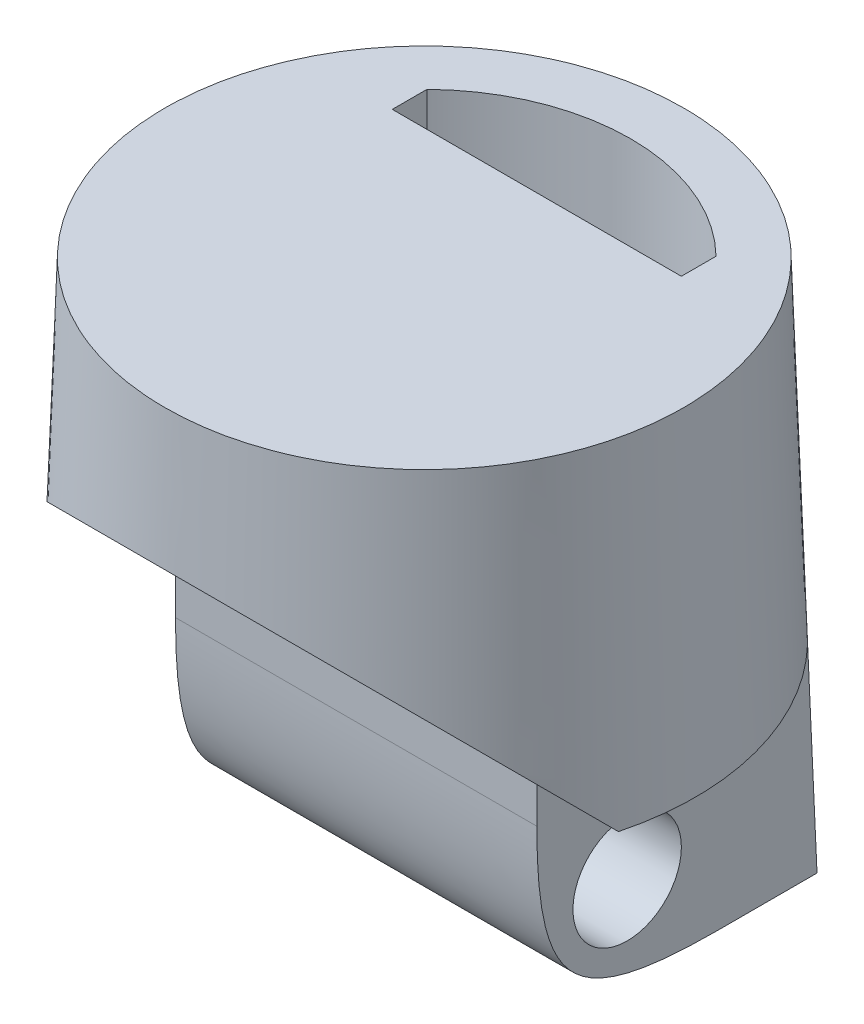
from build123d import *

# Parameters (mm, degrees)
SKETCH1_R                     = 7.5
BOSS_EXTRUDE1_DEPTH           = 19
BOSS_EXTRUDE1_TAPER           = 2
BOSS_EXTRUDE1_OTHER_WAY_DEPTH = 6
BOSS_EXTRUDE1_OTHER_WAY_TAPER = -2
CUT_EXTRUDE1_DEPTH            = 22.90601606
CUT_EXTRUDE1_DEPTH_BACK       = 22.90601606
CUT_EXTRUDE2_START            = -9.595582485
CUT_EXTRUDE2_OUTLINE_W        = 6.502745185
CUT_EXTRUDE2_OUTLINE_H        = 6
CUT_EXTRUDE2_DEPTH            = 9.595582485
SKETCH5_R                     = 1.5
CUT_EXTRUDE3_DEPTH            = 25.014303442
FILLET1_SIZE                  = 5
CUT_EXTRUDE4_DEPTH            = 22.833157665
CUT_EXTRUDE4_DEPTH_BACK       = 22.833157665
SKETCH6_W                     = 18.67842866
SKETCH6_H                     = 10.820279471
CUT_EXTRUDE5_DEPTH            = 19.604050317


with BuildPart() as part:
    # Sketch1 → Boss-Extrude1 (new body)
    with BuildSketch(Plane(origin=(0, 0, 0), x_dir=(1, 0, 0), z_dir=(0, 1, 0))):
        Circle(SKETCH1_R)
    extrude(amount=BOSS_EXTRUDE1_DEPTH, taper=BOSS_EXTRUDE1_TAPER)

    # Sketch1 → Boss-Extrude1 other way (add)
    with BuildSketch(Plane(origin=(0, 0, 0), x_dir=(1, 0, 0), z_dir=(0, 1, 0))):
        Circle(SKETCH1_R)
    extrude(amount=-BOSS_EXTRUDE1_OTHER_WAY_DEPTH, taper=BOSS_EXTRUDE1_OTHER_WAY_TAPER)

    # Sketch3 → Cut-Extrude1 (cut, two sides: drawn at the far end of the back side and taken through both)
    with BuildSketch(Plane(origin=(0, 0, 0), x_dir=(0, 0, -1), z_dir=(1, 0, 0)).offset(-CUT_EXTRUDE1_DEPTH_BACK)):
        Polygon((-1.886057768, -6), (-1.886057768, 0), (-9.929766736, 8.043708969), (-9.929766736, -6), align=None)
    extrude(amount=CUT_EXTRUDE1_DEPTH + CUT_EXTRUDE1_DEPTH_BACK, mode=Mode.SUBTRACT)

    # Cut-Extrude2: read off the stored shape, not the designer's step
    # Cut-Extrude2 outline → Cut-Extrude2 (cut)
    with BuildSketch(Plane.XY.offset(1.886057768).offset(CUT_EXTRUDE2_START)):
        with Locations((-8.251372593, -3)):
            Rectangle(CUT_EXTRUDE2_OUTLINE_W, CUT_EXTRUDE2_OUTLINE_H)
        with Locations((8.251372593, -3)):
            Rectangle(CUT_EXTRUDE2_OUTLINE_W, CUT_EXTRUDE2_OUTLINE_H)
    extrude(amount=CUT_EXTRUDE2_DEPTH, mode=Mode.SUBTRACT)

    # Sketch5 → Cut-Extrude3 (cut, through all)
    with BuildSketch(Plane(origin=(5, 0, 0), x_dir=(0, 0, -1), z_dir=(1, 0, 0))):
        with Locations((0.613942232, -3.5)):
            Circle(SKETCH5_R)
    extrude(amount=-CUT_EXTRUDE3_DEPTH, mode=Mode.SUBTRACT)

    # Fillet1
    # a fillet whose section is not a circle: 5 mm, written as the material it takes off along each edge
    with BuildSketch(Plane(origin=(17.5, -6, 1.886057768), x_dir=(0, 0, -1), z_dir=(-1, 0, 0))) as fillet1_piece_1:
        with BuildLine():
            Bezier((FILLET1_SIZE, 0), (0, 0), (0, -FILLET1_SIZE), weights=[1, 1.5, 1])
            Line((0, -FILLET1_SIZE), (0, 0))
            Line((0, 0), (FILLET1_SIZE, 0))
        make_face()
    extrude(amount=35, mode=Mode.SUBTRACT)

    # Fillet2
    # a fillet whose section is not a circle: 10, 5 mm, written as the material it takes off along each edge
    with BuildSketch(Plane(origin=(0, 19, 0), x_dir=(1, 0, 0), z_dir=(0, 0, -1))) as fillet2_piece_1:
        with BuildLine():
            Bezier((7.179619488, 9.825502516), (6.83650538, 0), (2.182665353, 0), weights=[1, 0.818181818, 1])
            Line((2.182665353, 0), (6.83650538, 0))
            Line((6.83650538, 0), (7.179619488, 9.825502516))
        make_face()
    revolve(axis=Axis((0, 19, 0), (0, -1, 0)), mode=Mode.SUBTRACT)

    # Sketch6 → Cut-Extrude4 (cut, two sides: drawn at the far end of the back side and taken through both)
    with BuildSketch(Plane(origin=(0, 0, 0), x_dir=(0, 0, -1), z_dir=(1, 0, 0)).offset(-CUT_EXTRUDE4_DEPTH_BACK)):
        with Locations((-1.153671222, 14.589860265)):
            Rectangle(SKETCH6_W, SKETCH6_H)
    extrude(amount=CUT_EXTRUDE4_DEPTH + CUT_EXTRUDE4_DEPTH_BACK, mode=Mode.SUBTRACT)

    # Sketch7 → Cut-Extrude5 (cut, through all)
    with BuildSketch(Plane.XZ.offset(6)):
        with BuildLine():
            Line((4, -3.113942232), (4, -4.074146702))
            ThreePointArc((4, -4.074146702), (0, -5.709524617), (-4, -4.074146702))
            Line((-4, -4.074146702), (-4, -3.113942232))
            Line((-4, -3.113942232), (4, -3.113942232))
        make_face()
    extrude(amount=-CUT_EXTRUDE5_DEPTH, mode=Mode.SUBTRACT)


solid = part.part
